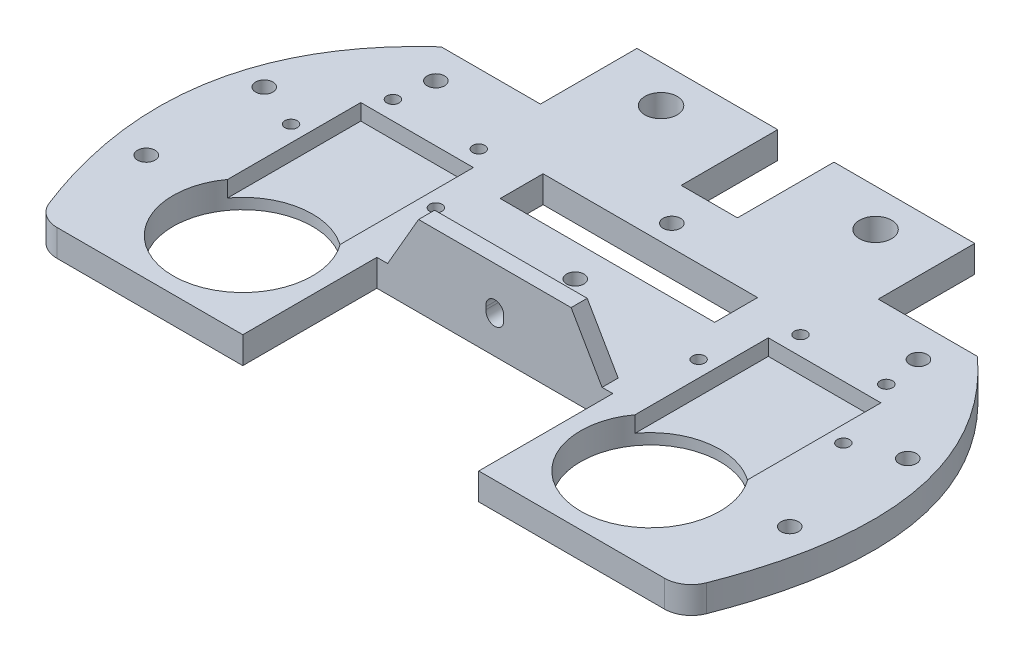
from build123d import *

# Parameters (mm, degrees)
SKETCH1_W           = 26.25
SKETCH1_H           = 22
SKETCH1_R           = 3
SKETCH1_R_2         = 13
BOSS_EXTRUDE1_DEPTH = 5
FILLET1_R           = 5
SKETCH2_R           = 1.625
CUT_EXTRUDE1_DEPTH  = 5
CUT_EXTRUDE2_START  = -5
SKETCH3_R           = 1.15
SKETCH3_R_2         = 13
CUT_EXTRUDE2_DEPTH  = 5
SKETCH5_W           = 20
SKETCH5_H           = 3
BOSS_EXTRUDE2_DEPTH = 10
SKETCH6_R           = 1.65
CUT_EXTRUDE4_DEPTH  = 28
CHAMFER1_SIZE       = 10
CHAMFER1_SIZE_2     = 17.320508076
SKETCH9_W           = 20
SKETCH9_H           = 5
CUT_EXTRUDE6_DEPTH  = 5
FILLET3_R           = 5
CUT_EXTRUDE9_START  = -3
CUT_EXTRUDE9_DEPTH  = 3
SKETCH16_W          = 40
SKETCH16_H          = 8
CUT_EXTRUDE11_DEPTH = 10
SKETCH17_W          = 88.86330123
SKETCH17_H          = 4
CUT_EXTRUDE12_DEPTH = 10


# Some blends are built 0.0001 mm under size
with BuildPart() as part:
    # Sketch1 → Boss-Extrude1 (new body)
    # profile 1 of 3: a face of its own
    with BuildSketch(Plane(origin=(0, 0, 0), x_dir=(1, 0, 0), z_dir=(0, 1, 0))):
        with Locations((18.375, 0)):
            Rectangle(SKETCH1_W, SKETCH1_H)
        with Locations(Location((20, 0, 0), (0, 0, 270))):
            Circle(SKETCH1_R, mode=Mode.SUBTRACT)
    # profile 2 of 3: a face of its own
    with BuildSketch(Plane(origin=(0, 0, 0), x_dir=(1, 0, 0), z_dir=(0, 1, 0))):
        with Locations((-18.375, 0)):
            Rectangle(SKETCH1_W, SKETCH1_H)
        with Locations(Location((-20, 0, 0), (0, 0, 270))):
            Circle(SKETCH1_R, mode=Mode.SUBTRACT)
    # profile 3 of 3: a face of its own
    with BuildSketch(Plane(origin=(0, 0, 0), x_dir=(1, 0, 0), z_dir=(0, 1, 0))):
        with BuildLine():
            Line((-5.25, -11), (-31.5, -11))
            Line((-31.5, -11), (-50, -11))
            add(Edge.make_bspline(
                [(-50, -11), (-77.2307176, -35.658609428), (-60, -76)],
                knots=[0, 0, 0, 1, 1, 1], degree=2))
            Line((-60, -76), (-22, -76))
            Line((-22, -76), (-22, -51))
            Line((-22, -51), (22, -51))
            Line((22, -51), (22, -76))
            Line((22, -76), (60, -76))
            add(Edge.make_bspline(
                [(50, -11), (77.2307176, -35.658609428), (60, -76)],
                knots=[0, 0, 0, 1, 1, 1], degree=2))
            Line((50, -11), (31.5, -11))
            Line((31.5, -11), (5.25, -11))
            Line((5.25, -11), (-5.25, -11))
        make_face()
        with Locations(Location((-38, -60, 0), (0, 0, 270))):
            Circle(SKETCH1_R_2, mode=Mode.SUBTRACT)
        with Locations(Location((38, -60, 0), (0, 0, 270))):
            Circle(SKETCH1_R_2, mode=Mode.SUBTRACT)
    extrude(amount=BOSS_EXTRUDE1_DEPTH)

    # Fillet1
    fillet1_edges = [part.edges().sort_by_distance(p)[0] for p in [
        (60, 2.5, 76),
        (-60, 2.5, 76),
    ]]
    fillet(fillet1_edges, radius=FILLET1_R)

    # Sketch2 → Cut-Extrude1 (cut)
    with BuildSketch(Plane(origin=(0, 5, 0), x_dir=(1, 0, 0), z_dir=(0, 1, 0))):
        with Locations(Location((-60, -56, 0), (0, 0, 270))):
            Circle(SKETCH2_R)
        with Locations(Location((60, -56, 0), (0, 0, 270))):
            Circle(SKETCH2_R)
        with Locations(Location((-45, -17, 0), (0, 0, 270))):
            Circle(SKETCH2_R)
        with Locations(Location((-60, -34, 0), (0, 0, 270))):
            Circle(SKETCH2_R)
        with Locations(Location((60, -34, 0), (0, 0, 270))):
            Circle(SKETCH2_R)
        with Locations(Location((45, -17, 0), (0, 0, 270))):
            Circle(SKETCH2_R)
        with Locations(Location((0, -18, 0), (0, 0, 270))):
            Circle(SKETCH2_R)
        with Locations(Location((0, -36, 0), (0, 0, 270))):
            Circle(SKETCH2_R)
    extrude(amount=-CUT_EXTRUDE1_DEPTH, mode=Mode.SUBTRACT)

    # Sketch3 → Cut-Extrude2 (cut)
    with BuildSketch(Plane(origin=(0, 5, 0), x_dir=(1, 0, 0), z_dir=(0, 1, 0)).offset(CUT_EXTRUDE2_START)):
        with Locations(Location((-30, -24, 0), (0, 0, 270))):
            Circle(SKETCH3_R)
        with Locations(Location((-38, -60, 0), (0, 0, 270))):
            Circle(SKETCH3_R_2)
        with Locations(Location((-24.5, -37.5, 0), (0, 0, 270))):
            Circle(SKETCH3_R)
        with Locations(Location((-46, -24, 0), (0, 0, 270))):
            Circle(SKETCH3_R)
        with Locations(Location((-51.5, -37.5, 0), (0, 0, 270))):
            Circle(SKETCH3_R)
        with Locations(Location((24.5, -37.5, 0), (0, 0, 270))):
            Circle(SKETCH3_R)
        with Locations(Location((30, -24, 0), (0, 0, 270))):
            Circle(SKETCH3_R)
        with Locations(Location((46, -24, 0), (0, 0, 270))):
            Circle(SKETCH3_R)
        with Locations(Location((51.5, -37.5, 0), (0, 0, 270))):
            Circle(SKETCH3_R)
    extrude(amount=CUT_EXTRUDE2_DEPTH, mode=Mode.SUBTRACT)

    # Sketch5 → Boss-Extrude2 (add)
    with BuildSketch(Plane(origin=(0, 5, 0), x_dir=(1, 0, 0), z_dir=(0, 1, 0))):
        with Locations((0, -49.5)):
            Rectangle(SKETCH5_W, SKETCH5_H)
    extrude(amount=BOSS_EXTRUDE2_DEPTH)

    # Sketch6 → Cut-Extrude4 (cut)
    with BuildSketch(Plane.XY.offset(76)):
        with Locations((0, 7)):
            Circle(SKETCH6_R)
        with Locations((0, 7.5)):
            Circle(SKETCH6_R)
        with Locations((0, 6.5)):
            Circle(SKETCH6_R)
    extrude(amount=-CUT_EXTRUDE4_DEPTH, mode=Mode.SUBTRACT)

    # Chamfer1
    # the kernel refuses this chamfer: 17.320508076, 10 mm, written as the material it adds along each edge
    with BuildSketch(Plane(origin=(-10, 5, 51), x_dir=(-0.9983227437537926, -0.05789386240267139, 0), z_dir=(0, 0, -1))) as chamfer1_piece_1_section:
        Polygon((CHAMFER1_SIZE * 0.998322743754, CHAMFER1_SIZE * 0.0578938624027), (-CHAMFER1_SIZE_2 * 0.0578938624016, CHAMFER1_SIZE_2 * 0.998322743736), (0, 0), align=None)
    chamfer1_piece_1 = extrude(amount=3, mode=Mode.PRIVATE)
    chamfer1_piece_1 = split(chamfer1_piece_1, bisect_by=Plane(origin=(-13.731694811, 15, 49.5), z_dir=(0, -1, 0)), keep=Keep.TOP, mode=Mode.PRIVATE)
    add(chamfer1_piece_1)
    with BuildSketch(Plane(origin=(10, 5, 48), x_dir=(0.9983227437537926, -0.05789386240267139, 0), z_dir=(0, 0, 1))) as chamfer1_piece_2_section:
        Polygon((CHAMFER1_SIZE * 0.998322743754, CHAMFER1_SIZE * 0.0578938624027), (-CHAMFER1_SIZE_2 * 0.0578938624016, CHAMFER1_SIZE_2 * 0.998322743736), (0, 0), align=None)
    chamfer1_piece_2 = extrude(amount=3, mode=Mode.PRIVATE)
    chamfer1_piece_2 = split(chamfer1_piece_2, bisect_by=Plane(origin=(13.731694811, 15, 49.5), z_dir=(0, -1, 0)), keep=Keep.TOP, mode=Mode.PRIVATE)
    add(chamfer1_piece_2)

    # Sketch9 → Cut-Extrude6 (cut)
    with BuildSketch(Plane(origin=(0, 5, 0), x_dir=(1, 0, 0), z_dir=(0, 1, 0))):
        with Locations((0, -45.5)):
            Rectangle(SKETCH9_W, SKETCH9_H)
    extrude(amount=-CUT_EXTRUDE6_DEPTH, mode=Mode.SUBTRACT)

    # Fillet3
    fillet3_edges = [part.edges().sort_by_distance(p)[0] for p in [
        (-10, 2.5, 43),
        (10, 2.5, 43),
    ]]
    fillet(fillet3_edges, radius=FILLET3_R - 0.0001)  # a hair under: the kernel refuses the full size

    # Sketch8 → Cut-Extrude9 (cut)
    with BuildSketch(Plane(origin=(0, 5, 0), x_dir=(1, 0, 0), z_dir=(0, 1, 0)).offset(CUT_EXTRUDE9_START)):
        with BuildLine():
            Line((-27.5, -27.5), (-48.5, -27.5))
            Line((-48.5, -27.5), (-48.5, -52.335145142))
            ThreePointArc((-48.5, -52.335145142), (-38, -47), (-27.5, -52.335145142))
            Line((-27.5, -52.335145142), (-27.5, -27.5))
        make_face()
        with BuildLine():
            ThreePointArc((27.5, -52.335145142), (38, -47), (48.5, -52.335145142))
            Line((48.5, -52.335145142), (48.5, -27.5))
            Line((48.5, -27.5), (27.5, -27.5))
            Line((27.5, -27.5), (27.5, -52.335145142))
        make_face()
    extrude(amount=CUT_EXTRUDE9_DEPTH, mode=Mode.SUBTRACT)

    # Sketch16 → Cut-Extrude11 (cut)
    with BuildSketch(Plane(origin=(0, 5, 0), x_dir=(1, 0, 0), z_dir=(0, 1, 0))):
        with Locations((0, -26)):
            Rectangle(SKETCH16_W, SKETCH16_H)
    extrude(amount=-CUT_EXTRUDE11_DEPTH, mode=Mode.SUBTRACT)

    # Sketch17 → Cut-Extrude12 (cut)
    with BuildSketch(Plane(origin=(0, 5, 0), x_dir=(1, 0, 0), z_dir=(0, 1, 0))):
        with Locations((-9.103732695, 9)):
            Rectangle(SKETCH17_W, SKETCH17_H)
    extrude(amount=-CUT_EXTRUDE12_DEPTH, mode=Mode.SUBTRACT)


solid = part.part
